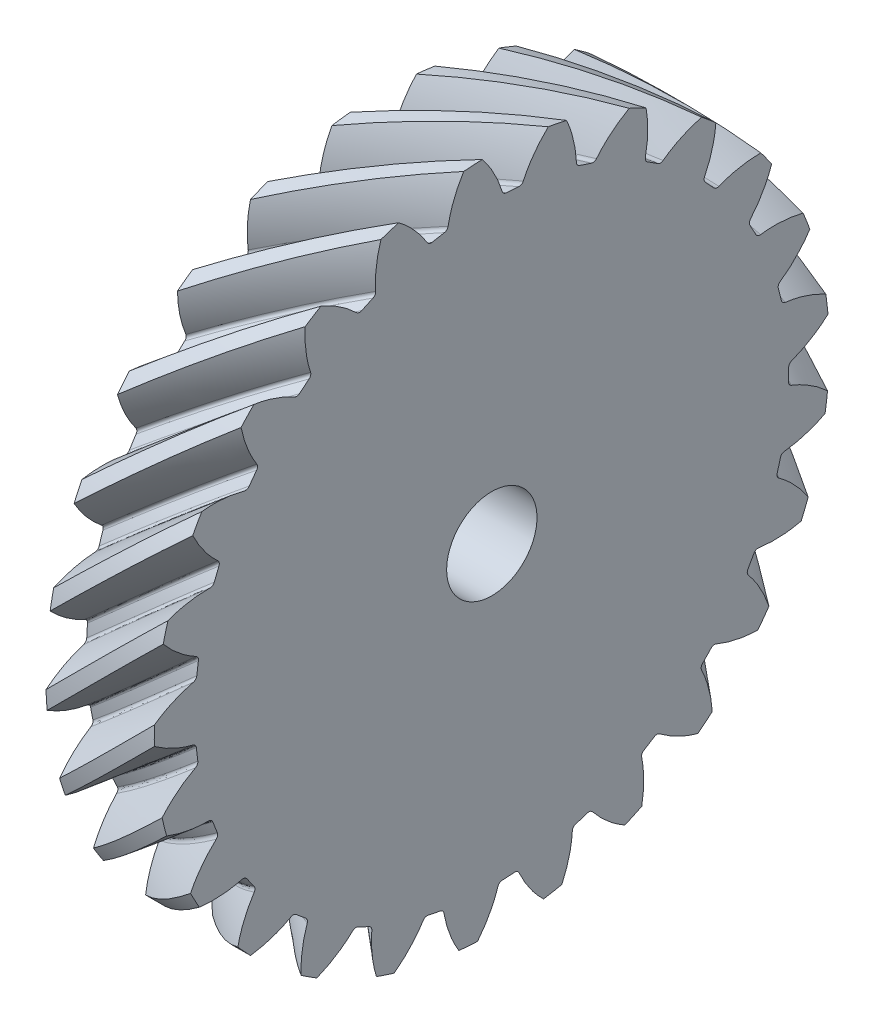
from build123d import *

# Parameters (mm, degrees)
BASPROSKE_W            = 12
BASPROSKE_H            = 37.355339059
TOOTHCUTLH_PITCH       = 234.710517522
TOOTHCUTLH_HEIGHT      = 12
TOOTHCUTLH_RADIUS      = 37.355339059
TOOTHCUTLH_START_ANGLE = -90
TEETHCUTSLH_COUNT      = 25
TEETHCUTSLH_ANGLE      = 345.6
BORSKE_R               = 5
BORE_DEPTH             = 62.5000025


with BuildPart() as part:
    # BasProSke → Base-Revolve (revolve)
    with BuildSketch(Plane(origin=(0, 0, 0), x_dir=(1, 0, 0), z_dir=(0, 1, 0)), mode=Mode.PRIVATE) as base_revolve_sk:
        with Locations((6, 18.67766953)):
            Rectangle(BASPROSKE_W, BASPROSKE_H)
    revolve(base_revolve_sk.sketch.rotate(Axis((-10, 0, 0), (1, 0, 0)), 180), axis=Axis((-10, 0, 0), (1, 0, 0)))

    # ToothCutLH: sweep along a helix
    with BuildLine() as toothcutlh_path:
        add(Helix(TOOTHCUTLH_PITCH, TOOTHCUTLH_HEIGHT, TOOTHCUTLH_RADIUS, center=(0, 0, 0), direction=(1, 0, 0), lefthand=True, mode=Mode.PRIVATE).rotate(Axis((0, 0, 0), (1, 0, 0)), TOOTHCUTLH_START_ANGLE))
    # TooCutSkeRH<3> → ToothCutLH (sweep, cut)
    with BuildSketch(Plane(origin=(0, 0, 0), x_dir=(0, 0, -1), z_dir=(1, 0, 0))):
        with BuildLine():
            ThreePointArc((0.689631832, 32.848100594), (0, 32.855339059), (-0.689631832, 32.848100594))
            ThreePointArc((-0.689631832, 32.848100594), (-0.979637077, 32.933193703), (-1.167931033, 33.169602809))
            ThreePointArc((-1.167931033, 33.169602809), (-2.624650425, 35.898978363), (-4.707088199, 38.186985185))
            ThreePointArc((-4.707088199, 38.186985185), (0, 38.475999231), (4.707088199, 38.186985185))
            ThreePointArc((4.707088199, 38.186985185), (2.624650425, 35.898978363), (1.167931033, 33.169602809))
            ThreePointArc((1.167931033, 33.169602809), (0.979637077, 32.933193703), (0.689631832, 32.848100594))
        make_face()
    toothcutlh = sweep(path=toothcutlh_path.line, is_frenet=True, mode=Mode.SUBTRACT)

    # TeethCutsLH: ToothCutLH ×25 about axis
    teethcutslh_axis = Axis((-10, 0, 0), (1, 0, 0))
    for i in range(1, TEETHCUTSLH_COUNT):
        add(toothcutlh.rotate(teethcutslh_axis, i * TEETHCUTSLH_ANGLE / (TEETHCUTSLH_COUNT - 1)), mode=Mode.SUBTRACT)

    # BorSke → Bore (cut, symmetric)
    with BuildSketch(Plane(origin=(0, 0, 0), x_dir=(0, 0, -1), z_dir=(1, 0, 0))):
        with Locations(Location((0, 0, 0), (0, 0, 180))):
            Circle(BORSKE_R)
    extrude(amount=BORE_DEPTH, both=True, mode=Mode.SUBTRACT)


solid = part.part
